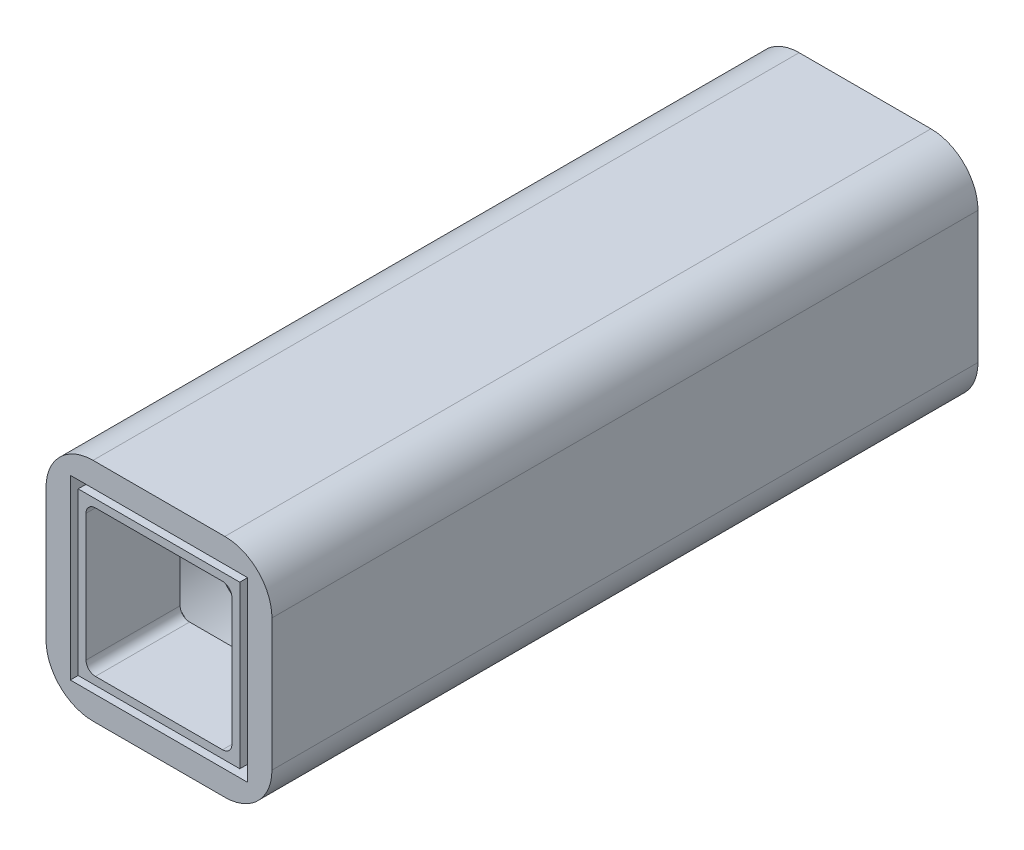
from build123d import *
from build123d.topology import SkipClean

# Parameters (mm, degrees)
SKETCH1_R           = 29.845
SKETCH1_R_2         = 26.67
BOSS_EXTRUDE1_DEPTH = 165.1
SKETCH2_W           = 59.69
SKETCH2_H           = 38.1
CUT_EXTRUDE1_DEPTH  = 171.409677102
BOSS_EXTRUDE2_DEPTH = 6.35
SKETCH5_R           = 29.845
SKETCH5_R_2         = 6.985
BOSS_EXTRUDE4_DEPTH = 6.35
BOSS_EXTRUDE5_START = -6.35
SKETCH4_R           = 29.845
SKETCH4_R_2         = 26.67
SKETCH4_R_3         = 6.985
BOSS_EXTRUDE5_DEPTH = 6.35
SKETCH6_W           = 60.96
SKETCH6_H           = 60.96
SKETCH6_R           = 29.845
BOSS_EXTRUDE7_DEPTH = 190.5
BOSS_EXTRUDE8_START = -25.4
SKETCH7_W           = 60.96
SKETCH7_H           = 60.96
SKETCH7_R           = 29.845
SKETCH7_W_2         = 39.37
SKETCH7_H_2         = 39.37
BOSS_EXTRUDE8_DEPTH = 25.4
SKETCH8_W           = 47.836836
SKETCH8_H           = 47.836836
SKETCH8_W_2         = 43.603672
SKETCH8_H_2         = 43.603672
CUT_EXTRUDE2_DEPTH  = 12.7
FILLET1_R           = 2.54
FILLET2_R           = 12.7


with BuildPart() as part:
    # Sketch1 → Boss-Extrude1 (new body)
    with BuildSketch(Plane.XY):
        Circle(SKETCH1_R)
        Circle(SKETCH1_R_2, mode=Mode.SUBTRACT)
    extrude(amount=BOSS_EXTRUDE1_DEPTH)

    # Sketch2 → Cut-Extrude1 (cut, through all)
    with BuildSketch(Plane(origin=(0, 0, 0), x_dir=(1, 0, 0), z_dir=(0, 1, 0))):
        with Locations((0, -18.194460122)):
            Rectangle(SKETCH2_W, SKETCH2_H)
    extrude(amount=-CUT_EXTRUDE1_DEPTH, mode=Mode.SUBTRACT)

    # Sketch3 → Boss-Extrude2 (add)
    with BuildSketch(Plane(origin=(0, 0, 0), x_dir=(-1, 0, 0), z_dir=(0, 0, -1))):
        with BuildLine():
            Line((-29.845, 0), (-6.985, 0))
            ThreePointArc((-6.985, 0), (0, 6.985), (6.985, 0))
            Line((6.985, 0), (29.845, 0))
            ThreePointArc((29.845, 0), (0, 29.845), (-29.845, 0))
        make_face()
    extrude(amount=-BOSS_EXTRUDE2_DEPTH)

    # Sketch5 → Boss-Extrude4 (add)
    with SkipClean():  # the faces are left unmerged after this step: merging them gives an invalid solid
        with BuildSketch(Plane(origin=(0, 0, 0), x_dir=(-1, 0, 0), z_dir=(0, 0, -1))):
            with Locations(Location((0, 0, 0), (0, 0, 180))):
                Circle(SKETCH5_R)
            with BuildLine():
                Line((26.639744744, 1.27), (9.33422749, 1.465384615))
                ThreePointArc((9.33422749, 1.465384615), (6.689709997, 6.703146826), (1.477288556, 9.397267918))
                Line((1.477288556, 9.397267918), (1.27, 26.639744744))
                ThreePointArc((1.27, 26.639744744), (18.858537854, 18.858537854), (26.639744744, 1.27))
            make_face(mode=Mode.SUBTRACT)
            with BuildLine():
                Line((-1.27, 26.639744744), (-1.27, 9.45004085))
                ThreePointArc((-1.27, 9.45004085), (-6.784923303, 6.762723487), (-9.517329266, 1.27))
                Line((-9.517329266, 1.27), (-26.639744744, 1.27))
                ThreePointArc((-26.639744744, 1.27), (-18.858537854, 18.858537854), (-1.27, 26.639744744))
            make_face(mode=Mode.SUBTRACT)
            Circle(SKETCH5_R_2, mode=Mode.SUBTRACT)
        extrude(amount=-BOSS_EXTRUDE4_DEPTH)

    # Sketch4 → Boss-Extrude5 (add)
    # profile 1 of 2: a face of its own
    with SkipClean():  # the faces are left unmerged after this step: merging them gives an invalid solid
        with BuildSketch(Plane.XY.offset(165.1).offset(BOSS_EXTRUDE5_START)):
            Circle(SKETCH4_R)
            with Locations(Location((0, 0, 0), (0, 0, 180))):
                Circle(SKETCH4_R_2, mode=Mode.SUBTRACT)
        # profile 2 of 2: a face of its own
        with BuildSketch(Plane.XY.offset(165.1).offset(BOSS_EXTRUDE5_START)):
            with BuildLine():
                Line((1.27, 9.45004085), (1.27, 26.639744744))
                ThreePointArc((1.27, 26.639744744), (0, 26.67), (-1.27, 26.639744744))
                Line((-1.27, 26.639744744), (-1.477288556, 9.397267918))
                ThreePointArc((-1.477288556, 9.397267918), (-6.689709997, 6.703146826), (-9.33422749, 1.465384615))
                Line((-9.33422749, 1.465384615), (-26.639744744, 1.27))
                ThreePointArc((-26.639744744, 1.27), (-26.67, 0), (-26.639744744, -1.27))
                Line((-26.639744744, -1.27), (-9.33422749, -1.465384615))
                ThreePointArc((-9.33422749, -1.465384615), (-6.689709997, -6.703146826), (-1.477288556, -9.397267918))
                Line((-1.477288556, -9.397267918), (-1.27, -26.639744744))
                ThreePointArc((-1.27, -26.639744744), (0, -26.67), (1.27, -26.639744744))
                Line((1.27, -26.639744744), (1.453480675, -9.425070814))
                ThreePointArc((1.453480675, -9.425070814), (6.780569847, -6.767038646), (9.488978712, -1.465384615))
                Line((9.488978712, -1.465384615), (26.639744744, -1.27))
                ThreePointArc((26.639744744, -1.27), (26.662435113, -0.635180167), (26.67, 0))
                ThreePointArc((26.67, 0), (26.662435113, 0.635180167), (26.639744744, 1.27))
                Line((26.639744744, 1.27), (9.517329266, 1.27))
                ThreePointArc((9.517329266, 1.27), (6.784923303, 6.762723487), (1.27, 9.45004085))
            make_face()
            with Locations(Location((0, 0, 0), (0, 0, 180))):
                Circle(SKETCH4_R_3, mode=Mode.SUBTRACT)
        extrude(amount=BOSS_EXTRUDE5_DEPTH)

    # Sketch6 → Boss-Extrude7 (add)
    with BuildSketch(Plane.XY):
        Rectangle(SKETCH6_W, SKETCH6_H)
        Circle(SKETCH6_R, mode=Mode.SUBTRACT)
    extrude(amount=BOSS_EXTRUDE7_DEPTH)

    # Sketch7 → Boss-Extrude8 (add)
    # profile 1 of 2: a face of its own
    with BuildSketch(Plane.XY.offset(190.5).offset(BOSS_EXTRUDE8_START)):
        Rectangle(SKETCH7_W, SKETCH7_H)
        Circle(SKETCH7_R, mode=Mode.SUBTRACT)
    # profile 2 of 2: a face of its own
    with BuildSketch(Plane.XY.offset(190.5).offset(BOSS_EXTRUDE8_START)):
        Circle(SKETCH7_R)
        Rectangle(SKETCH7_W_2, SKETCH7_H_2, mode=Mode.SUBTRACT)
    extrude(amount=BOSS_EXTRUDE8_DEPTH)

    # Sketch8 → Cut-Extrude2 (cut)
    with BuildSketch(Plane.XY.offset(190.5)):
        Rectangle(SKETCH8_W, SKETCH8_H)
        Rectangle(SKETCH8_W_2, SKETCH8_H_2, mode=Mode.SUBTRACT)
    extrude(amount=-CUT_EXTRUDE2_DEPTH, mode=Mode.SUBTRACT)

    # Fillet1
    # the kernel refuses this fillet: 2.54 mm, written as the material it adds along each edge
    with BuildSketch(Plane(origin=(19.685, -19.685, 165.1), x_dir=(-1, 0, 0), z_dir=(0, 0, 1)), Plane(origin=(19.685, 19.685, 165.1), x_dir=(0, -1, 0), z_dir=(0, 0, 1)), Plane(origin=(-19.685, -19.685, 165.1), x_dir=(0, 1, 0), z_dir=(0, 0, 1))) as fillet1_piece_1:
        with BuildLine():
            CenterArc((FILLET1_R, -FILLET1_R), FILLET1_R, 90, 90)
            Line((0, -FILLET1_R), (0, 0))
            Line((0, 0), (FILLET1_R, 0))
        make_face()
    extrude(amount=25.4)
    with BuildSketch(Plane(origin=(-19.685, 19.685, 165.1), x_dir=(0, -1, 0), z_dir=(0, 0, 1))) as fillet1_piece_2:
        with BuildLine():
            CenterArc((FILLET1_R, FILLET1_R), FILLET1_R, 180, 90)
            Line((0, FILLET1_R), (0, 0))
            Line((0, 0), (FILLET1_R, 0))
        make_face()
    extrude(amount=25.4)

    # Fillet2
    fillet2_edges = [part.edges().sort_by_distance(p)[0] for p in [
        (-30.48, 30.48, 95.25),
        (-30.48, -30.48, 95.25),
        (30.48, -30.48, 95.25),
        (30.48, 30.48, 95.25),
    ]]
    fillet(fillet2_edges, radius=FILLET2_R)


solid = part.part
